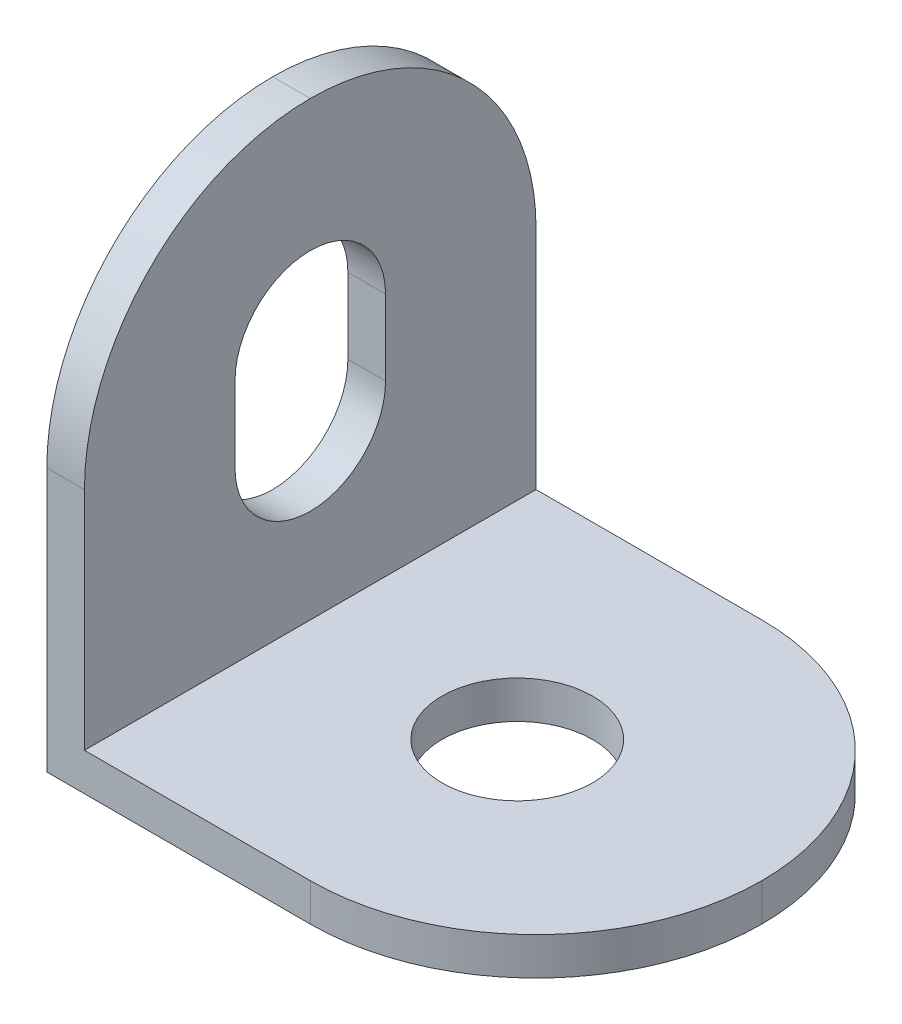
from build123d import *

# Parameters (mm, degrees)
BOSS_EXTRUDE1_DEPTH = 12
CUT_EXTRUDE1_DEPTH  = 22.9544984
SKETCH3_R           = 2
CUT_EXTRUDE2_DEPTH  = 22.9544984
FILLET1_R           = 6


with BuildPart() as part:
    # Sketch1 → Boss-Extrude1 (new body)
    with BuildSketch(Plane.XY):
        Polygon((0, 0), (13, 0), (13, 1), (1, 1), (1, 13), (0, 13), align=None)
    extrude(amount=BOSS_EXTRUDE1_DEPTH)

    # Sketch2 → Cut-Extrude1 (cut, through all)
    with BuildSketch(Plane.ZY):
        with BuildLine():
            Line((4, 5.5), (4, 7.5))
            ThreePointArc((4, 7.5), (6, 9.5), (8, 7.5))
            Line((8, 7.5), (8, 5.5))
            ThreePointArc((8, 5.5), (6, 3.5), (4, 5.5))
        make_face()
    extrude(amount=-CUT_EXTRUDE1_DEPTH, mode=Mode.SUBTRACT)

    # Sketch3 → Cut-Extrude2 (cut, through all)
    with BuildSketch(Plane.XZ):
        with Locations(Location((6.5, 6, 0), (0, 0, 270))):
            Circle(SKETCH3_R)
    extrude(amount=-CUT_EXTRUDE2_DEPTH, mode=Mode.SUBTRACT)

    # Fillet1
    fillet1_edges = [part.edges().sort_by_distance(p)[0] for p in [
        (0.5, 13, 0),
        (13, 0.5, 0),
        (13, 0.5, 12),
        (0.5, 13, 12),
    ]]
    fillet(fillet1_edges, radius=FILLET1_R - 0.0001)  # a hair under: the kernel refuses the full size


solid = part.part
